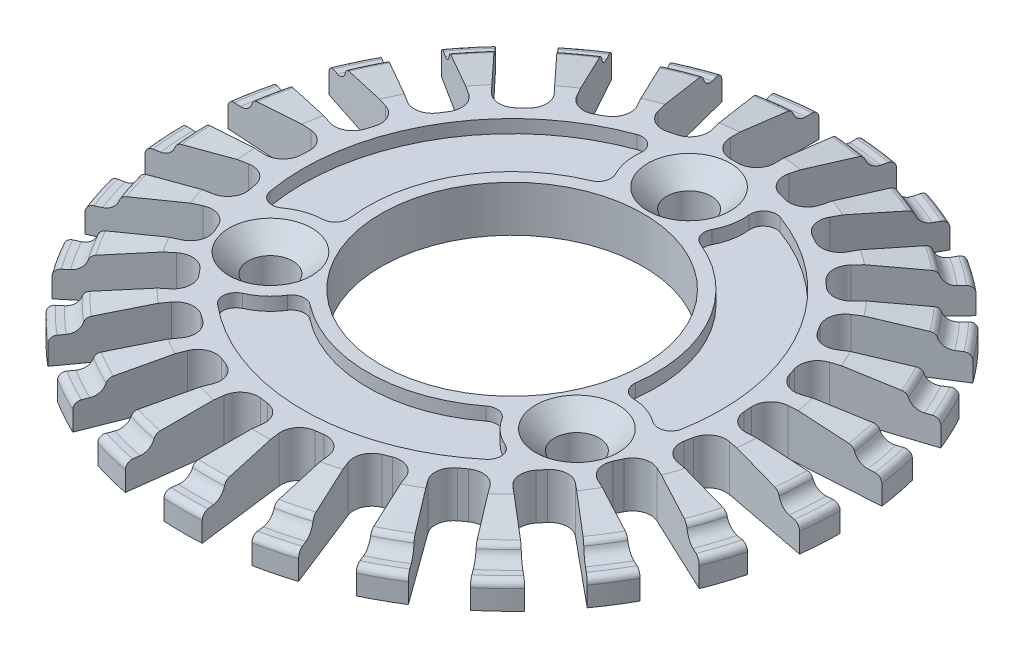
from build123d import *

# Parameters (mm, degrees)
SKETCH1_R                = 25.15
BOSS_EXTRUDE1_DEPTH      = 2
SKETCH2_R                = 23.15
BOSS_EXTRUDE2_DEPTH      = 1.5
FILLET1_R                = 1
FILLET2_R                = 0.5
CHAMFER1_SIZE            = 0.5
CHAMFER1_SIZE_2          = 4
FILLET3_R                = 0.5
CUT_EXTRUDE1_START       = -36.623657869
CUT_EXTRUDE1_DEPTH       = 38.623657869
FILLET4_R                = 1.4
CIRPATTERN1_COUNT        = 25
FILLET4_OF_CIRPATTERN1_R = 1.4
SKETCH5_R                = 10
CUT_EXTRUDE2_DEPTH       = 36.739075811
CIRPATTERN2_COUNT        = 3
CUT_EXTRUDE3_DEPTH       = 1
FILLET5_R                = 1
CIRPATTERN3_COUNT        = 3
FILLET5_OF_CIRPATTERN3_R = 1


with BuildPart() as part:
    # Sketch1 → Boss-Extrude1 (new body)
    with BuildSketch(Plane(origin=(0, 0, 0), x_dir=(1, 0, 0), z_dir=(0, 1, 0))):
        with Locations(Location((0, 0, 0), (0, 0, 270))):
            Circle(SKETCH1_R)
    extrude(amount=BOSS_EXTRUDE1_DEPTH)

    # Sketch2 → Boss-Extrude2 (add)
    with BuildSketch(Plane(origin=(0, 2, 0), x_dir=(1, 0, 0), z_dir=(0, 1, 0))):
        with Locations(Location((0, 0, 0), (0, 0, 270))):
            Circle(SKETCH2_R)
    extrude(amount=BOSS_EXTRUDE2_DEPTH)

    # Fillet1
    fillet1_edges = [part.edges().sort_by_distance(p)[0] for p in [
        (0, 2, -23.15),
    ]]
    fillet(fillet1_edges, radius=FILLET1_R)

    # Fillet2
    fillet2_edges = [part.edges().sort_by_distance(p)[0] for p in [
        (0, 2, -25.15),
    ]]
    fillet(fillet2_edges, radius=FILLET2_R)

    # Chamfer1
    # the kernel refuses this chamfer: 4, 0.5 mm, written as the material it takes off along each edge
    with BuildSketch(Plane(origin=(0, 3.5, 0), x_dir=(0, 0, 1), z_dir=(-1, 0, 0))) as chamfer1_piece_1:
        Polygon((23.15, -CHAMFER1_SIZE), (23.15 - CHAMFER1_SIZE_2, 0), (23.15, 0), align=None)
    revolve(axis=Axis((0, 3.5, 0), (0, 1, 0)), mode=Mode.SUBTRACT)

    # Fillet3
    fillet3_edges = [part.edges().sort_by_distance(p)[0] for p in [
        (0, 3, -23.15),
    ]]
    fillet(fillet3_edges, radius=FILLET3_R)

    # Sketch4 → Cut-Extrude1 (cut)
    with BuildSketch(Plane(origin=(0, 2, 0), x_dir=(1, 0, 0), z_dir=(0, 1, 0)).offset(CUT_EXTRUDE1_START)):
        with BuildLine():
            Line((-1.695, 27.5), (1.695, 27.5))
            Line((1.695, 27.5), (1.695, 17))
            ThreePointArc((1.695, 17), (0, 16.947713475), (-1.695, 17))
            Line((-1.695, 17), (-1.695, 27.5))
        make_face()
    cut_extrude1 = extrude(amount=CUT_EXTRUDE1_DEPTH, mode=Mode.SUBTRACT)

    # Fillet4
    fillet4_edges = [part.edges().sort_by_distance(p)[0] for p in [
        (1.695, 1.75, -17),
        (-1.695, 1.75, -17),
    ]]
    fillet(fillet4_edges, radius=FILLET4_R)

    # CirPattern1: Cut-Extrude1 ×25 about axis
    cirpattern1_axis = Axis((0, 0, 0), (0, 1, 0))
    for i in range(1, CIRPATTERN1_COUNT):
        add(cut_extrude1.rotate(cirpattern1_axis, i * 360 / CIRPATTERN1_COUNT), mode=Mode.SUBTRACT)

    # Fillet4 of CirPattern1
    fillet4_of_cirpattern1_edges = [part.edges().sort_by_distance(p)[0] for p in [
        (-2.585979624, 1.75, -16.887443098),
        (-5.86947654, 1.75, -16.04438438),
        (-6.704472637, 1.75, -15.713786038),
        (-9.675152282, 1.75, -14.080641083),
        (-10.401698977, 1.75, -13.552774011),
        (-12.872902624, 1.75, -11.232159322),
        (-13.445348316, 1.75, -10.540191348),
        (-15.261801151, 1.75, -7.677919681),
        (-15.644176972, 1.75, -6.865329699),
        (-16.691744582, 1.75, -3.641248109),
        (-16.860024453, 1.75, -2.759094137),
        (-17.072884314, 1.75, 0.624216473),
        (-17.016494591, 1.75, 1.520505458),
        (-16.381271934, 1.75, 4.850459238),
        (-16.103755791, 1.75, 5.704566103),
        (-14.660363993, 1.75, 8.771929811),
        (-14.17915879, 1.75, 9.530187879),
        (-12.018291465, 1.75, 12.142227772),
        (-11.363633094, 1.75, 12.756992902),
        (-8.621065484, 1.75, 14.749584907),
        (-7.834088539, 1.75, 15.182229143),
        (-4.682146252, 1.75, 16.430171377),
        (-3.812299389, 1.75, 16.653510091),
        (-0.449030552, 1.75, 17.078389753),
        (0.449030552, 1.75, 17.078389753),
        (3.812299389, 1.75, 16.653510091),
        (4.682146252, 1.75, 16.430171377),
        (7.834088539, 1.75, 15.182229143),
        (8.621065484, 1.75, 14.749584907),
        (11.363633094, 1.75, 12.756992902),
        (12.018291465, 1.75, 12.142227772),
        (14.17915879, 1.75, 9.530187879),
        (14.660363993, 1.75, 8.771929811),
        (16.103755791, 1.75, 5.704566103),
        (16.381271934, 1.75, 4.850459238),
        (17.016494591, 1.75, 1.520505458),
        (17.072884314, 1.75, 0.624216473),
        (16.860024453, 1.75, -2.759094137),
        (16.691744582, 1.75, -3.641248109),
        (15.644176972, 1.75, -6.865329699),
        (15.261801151, 1.75, -7.677919681),
        (13.445348316, 1.75, -10.540191348),
        (12.872902624, 1.75, -11.232159322),
        (10.401698977, 1.75, -13.552774011),
        (9.675152282, 1.75, -14.080641083),
        (6.704472637, 1.75, -15.713786038),
        (5.86947654, 1.75, -16.04438438),
        (2.585979624, 1.75, -16.887443098),
    ]]
    fillet(fillet4_of_cirpattern1_edges, radius=FILLET4_OF_CIRPATTERN1_R)

    # Sketch5 → Cut-Extrude2 (cut, through all)
    with BuildSketch(Plane(origin=(0, 3.5, 0), x_dir=(1, 0, 0), z_dir=(0, 1, 0))):
        with Locations(Location((0, 0, 0), (0, 0, 270))):
            Circle(SKETCH5_R)
    extrude(amount=-CUT_EXTRUDE2_DEPTH, mode=Mode.SUBTRACT)

    # Sketch8 → CSK for M3 Countersunk Flat Head Screw1 (revolve, cut)
    with BuildSketch(Plane(origin=(0, 3.5, -13.5), x_dir=(0, 0, 1), z_dir=(1, 0, 0))):
        Polygon((0, 0), (0, 13.021463052), (1.7, 12), (1.7, 1.45), (3.15, 0), align=None)
    csk_for_m3_countersunk_flat_head_screw1 = revolve(axis=Axis((0, 9.85, -13.5), (0, -1, 0)), mode=Mode.SUBTRACT)

    # CirPattern2: CSK for M3 Countersunk Flat Head Screw1 ×3 about axis
    cirpattern2_axis = Axis((0, 0, 0), (0, 1, 0))
    for i in range(1, CIRPATTERN2_COUNT):
        add(csk_for_m3_countersunk_flat_head_screw1.rotate(cirpattern2_axis, i * 360 / CIRPATTERN2_COUNT), mode=Mode.SUBTRACT)

    # Sketch9 → Cut-Extrude3 (cut)
    with BuildSketch(Plane(origin=(0, 3.5, 0), x_dir=(1, 0, 0), z_dir=(0, 1, 0))):
        with BuildLine():
            ThreePointArc((-3.614650532, 15.538823565), (-13.816314711, 7.976853018), (-15.264341218, -4.639032596))
            ThreePointArc((-15.264341218, -4.639032596), (-13.27851116, -2.91549911), (-10.655501728, -2.731351849))
            ThreePointArc((-10.655501728, -2.731351849), (-9.526279442, 5.5), (-2.962330776, 10.593611111))
            ThreePointArc((-2.962330776, 10.593611111), (-4.114359286, 12.957277544), (-3.614650532, 15.538823565))
        make_face()
    cut_extrude3 = extrude(amount=-CUT_EXTRUDE3_DEPTH, mode=Mode.SUBTRACT)

    # Fillet5
    fillet5_edges = [part.edges().sort_by_distance(p)[0] for p in [
        (-3.614650532, 3, -15.538823565),
        (-2.962330776, 3, -10.593611111),
        (-10.655501728, 3, 2.731351849),
        (-15.264341218, 3, 4.639032596),
    ]]
    fillet(fillet5_edges, radius=FILLET5_R)

    # CirPattern3: Cut-Extrude3 ×3 about axis
    cirpattern3_axis = Axis((0, 0, 0), (0, 1, 0))
    for i in range(1, CIRPATTERN3_COUNT):
        add(cut_extrude3.rotate(cirpattern3_axis, i * 360 / CIRPATTERN3_COUNT), mode=Mode.SUBTRACT)

    # Fillet5 of CirPattern3
    fillet5_of_cirpattern3_edges = [part.edges().sort_by_distance(p)[0] for p in [
        (-11.649690686, 3, 10.899790969),
        (-7.693170952, 3, 7.862259262),
        (7.693170952, 3, 7.862259262),
        (11.649690686, 3, 10.899790969),
        (15.264341218, 3, 4.639032596),
        (10.655501728, 3, 2.731351849),
        (2.962330776, 3, -10.593611111),
        (3.614650532, 3, -15.538823565),
    ]]
    fillet(fillet5_of_cirpattern3_edges, radius=FILLET5_OF_CIRPATTERN3_R)


solid = part.part
